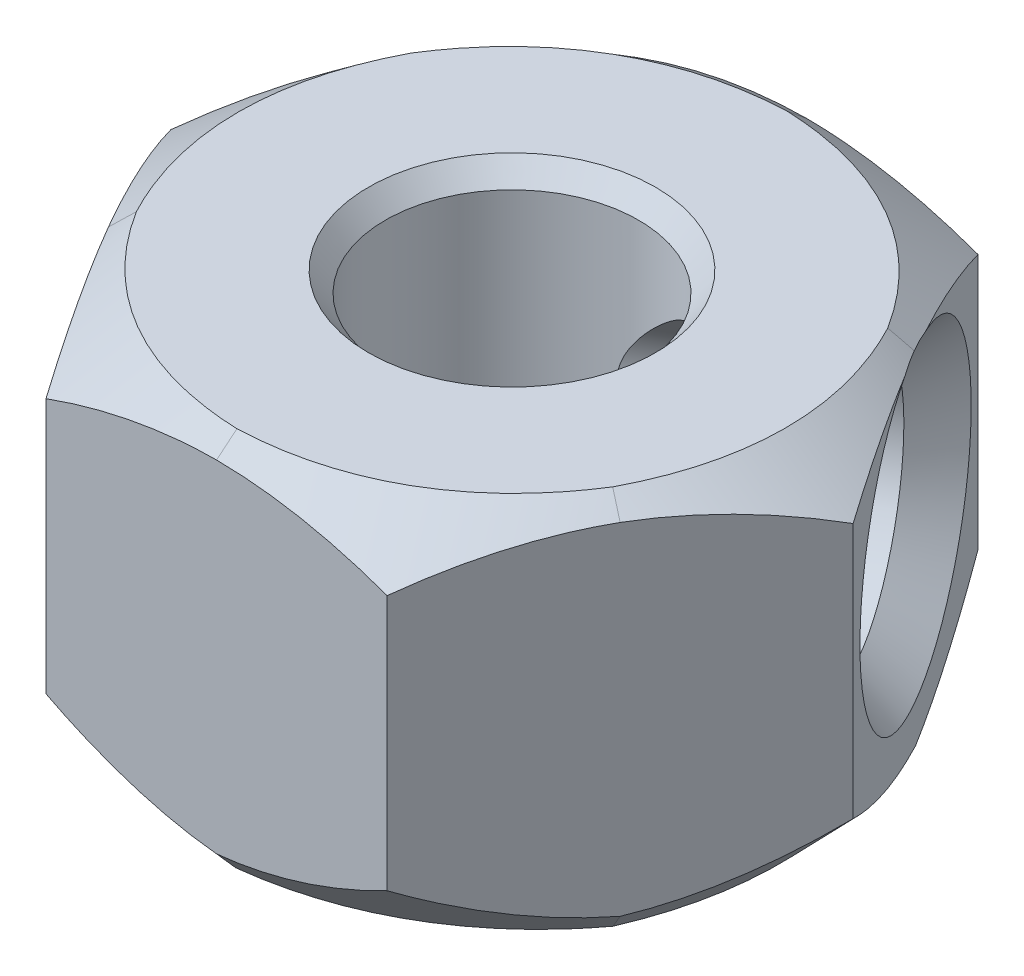
from build123d import *
from OCP.BRepFilletAPI import BRepFilletAPI_MakeChamfer

# Parameters (mm, degrees)
SKETCH1_R           = 1.5
BOSS_EXTRUDE1_DEPTH = 4.5
CHAMFER1_SIZE       = 0.2
CHAMFER1_SIZE2      = 0.238350719
SKETCH2_R           = 1.4
CUT_EXTRUDE1_DEPTH  = 3
CHAMFER2_SIZE       = 0.4
CHAMFER2_SIZE_2     = 0.476701437
FILLET1_R           = 5.5


with BuildPart() as part:
    # Sketch1 → Boss-Extrude1 (new body)
    with BuildSketch(Plane(origin=(0, 0, 0), x_dir=(1, 0, 0), z_dir=(0, 1, 0))):
        Polygon((4.041451884, 0), (2.020725942, 3.5), (-2.020725942, 3.5), (-4.041451884, 0), (-2.020725942, -3.5), (2.020725942, -3.5), align=None)
        with Locations(Location((0, 0, 0), (0, 0, 270))):
            Circle(SKETCH1_R, mode=Mode.SUBTRACT)
    extrude(amount=BOSS_EXTRUDE1_DEPTH)

    # Chamfer1: one chamfer whose edges measure the first distance from different faces: ONE call of the kernel's chamfer builder (chamfer() names one face for all edges)
    chamfer1_edges_1 = [part.edges().sort_by_distance(p)[0] for p in [
        (0, 4.5, -3.5),
    ]]
    chamfer1_side_1 = [part.faces().sort_by_distance(p)[0] for p in [
        (0, 2.25, -3.5),
    ]]
    chamfer1_edges_2 = [part.edges().sort_by_distance(p)[0] for p in [
        (-3.031088913, 4.5, -1.75),
    ]]
    chamfer1_side_2 = [part.faces().sort_by_distance(p)[0] for p in [
        (-3.031088913, 2.25, -1.75),
    ]]
    chamfer1_edges_3 = [part.edges().sort_by_distance(p)[0] for p in [
        (-3.031088913, 4.5, 1.75),
    ]]
    chamfer1_side_3 = [part.faces().sort_by_distance(p)[0] for p in [
        (-3.031088913, 2.25, 1.75),
    ]]
    chamfer1_edges_4 = [part.edges().sort_by_distance(p)[0] for p in [
        (0, 0, -1.5),
    ]]
    chamfer1_side_4 = [part.faces().sort_by_distance(p)[0] for p in [
        (0, 2.25, -1.5),
    ]]
    chamfer1_edges_5 = [part.edges().sort_by_distance(p)[0] for p in [
        (0, 4.5, -1.5),
    ]]
    chamfer1_side_5 = [part.faces().sort_by_distance(p)[0] for p in [
        (2.938487617, 4.5, -1.696536617),
    ]]
    chamfer1_edges_6 = [part.edges().sort_by_distance(p)[0] for p in [
        (0, 4.5, 3.5),
    ]]
    chamfer1_side_6 = [part.faces().sort_by_distance(p)[0] for p in [
        (0, 2.25, 3.5),
    ]]
    chamfer1_edges_7 = [part.edges().sort_by_distance(p)[0] for p in [
        (3.031088913, 4.5, 1.75),
    ]]
    chamfer1_side_7 = [part.faces().sort_by_distance(p)[0] for p in [
        (3.031088913, 2.25, 1.75),
    ]]
    chamfer1_edges_8 = [part.edges().sort_by_distance(p)[0] for p in [
        (0, 0, 3.5),
        (-3.031088913, 0, 1.75),
        (-3.031088913, 0, -1.75),
        (0, 0, -3.5),
        (3.031088913, 0, -1.75),
        (3.031088913, 0, 1.75),
    ]]
    chamfer1_side_8 = [part.faces().sort_by_distance(p)[0] for p in [
        (2.938487617, 0, -1.696536617),
    ]]
    chamfer1_edges_9 = [part.edges().sort_by_distance(p)[0] for p in [
        (3.031088913, 4.5, -1.75),
    ]]
    chamfer1_side_9 = [part.faces().sort_by_distance(p)[0] for p in [
        (3.031088913, 2.25, -1.75),
    ]]
    chamfer1 = BRepFilletAPI_MakeChamfer(part.part.solid().wrapped)
    for e in chamfer1_edges_1:
        chamfer1.Add(CHAMFER1_SIZE, CHAMFER1_SIZE2, e.wrapped, chamfer1_side_1[0].wrapped)  # the first distance lies on this face
    for e in chamfer1_edges_2:
        chamfer1.Add(CHAMFER1_SIZE, CHAMFER1_SIZE2, e.wrapped, chamfer1_side_2[0].wrapped)  # the first distance lies on this face
    for e in chamfer1_edges_3:
        chamfer1.Add(CHAMFER1_SIZE, CHAMFER1_SIZE2, e.wrapped, chamfer1_side_3[0].wrapped)  # the first distance lies on this face
    for e in chamfer1_edges_4:
        chamfer1.Add(CHAMFER1_SIZE, CHAMFER1_SIZE2, e.wrapped, chamfer1_side_4[0].wrapped)  # the first distance lies on this face
    for e in chamfer1_edges_5:
        chamfer1.Add(CHAMFER1_SIZE, CHAMFER1_SIZE2, e.wrapped, chamfer1_side_5[0].wrapped)  # the first distance lies on this face
    for e in chamfer1_edges_6:
        chamfer1.Add(CHAMFER1_SIZE, CHAMFER1_SIZE2, e.wrapped, chamfer1_side_6[0].wrapped)  # the first distance lies on this face
    for e in chamfer1_edges_7:
        chamfer1.Add(CHAMFER1_SIZE, CHAMFER1_SIZE2, e.wrapped, chamfer1_side_7[0].wrapped)  # the first distance lies on this face
    for e in chamfer1_edges_8:
        chamfer1.Add(CHAMFER1_SIZE, CHAMFER1_SIZE2, e.wrapped, chamfer1_side_8[0].wrapped)  # the first distance lies on this face
    for e in chamfer1_edges_9:
        chamfer1.Add(CHAMFER1_SIZE, CHAMFER1_SIZE2, e.wrapped, chamfer1_side_9[0].wrapped)  # the first distance lies on this face
    add(Compound.cast(chamfer1.Shape()), mode=Mode.REPLACE)

    # Sketch2 → Cut-Extrude1 (cut)
    with BuildSketch(Plane(origin=(3.031088913, 0, -1.75), x_dir=(-0.5, 0, -0.8660254037844386), z_dir=(0.8660254037844387, 0, -0.5000000000000001))):
        with Locations((0, 2.519175359)):
            Circle(SKETCH2_R)
    extrude(amount=-CUT_EXTRUDE1_DEPTH, mode=Mode.SUBTRACT)

    # Chamfer2
    # the kernel refuses this chamfer: 0.476701437, 0.4 mm, written as the material it takes off along each edge
    with BuildSketch(Plane(origin=(3.031088913, 2.519175359, -1.75), x_dir=(-0.5000000000000001, 0, -0.8660254037844386), z_dir=(0, -1, 0))) as chamfer2_piece_1:
        Polygon((1.4 + CHAMFER2_SIZE, 0), (1.4, -CHAMFER2_SIZE_2), (1.4, 0), align=None)
    revolve(axis=Axis((3.031088913, 2.519175359, -1.75), (0.8660254037844387, 0, -0.5000000000000001)), mode=Mode.SUBTRACT)

    # Fillet1
    # the kernel refuses this fillet: 5.5 mm, written as the material it takes off along each edge
    with BuildSketch(Plane(origin=(0.15679227, -4.094610415, 0), x_dir=(0.2750801350308494, 0.26652756240167075, 0.9237391286459793), z_dir=(-0.6958540455341976, 0.7181832268395656, -6.118874277733391e-15)), Plane(origin=(-0.15679227, -4.094610415, 0), x_dir=(-0.2750801350308542, 0.2665275624016659, -0.9237391286459793), z_dir=(0.6958540455341957, 0.7181832268395675, 0)), Plane(origin=(-0.078396135, -4.094610415, -0.135786089), x_dir=(0.6624414843616913, 0.266527562401667, -0.7000959493361638), z_dir=(0.347927022767099, 0.7181832268395667, 0.6026272807587874)), Plane(origin=(0.078396135, -4.094610415, -0.135786089), x_dir=(0.937521619392547, 0.2665275624016655, 0.2236431793098164), z_dir=(-0.3479270227670974, 0.718183226839567, 0.6026272807587876))) as fillet1_piece_1:
        with BuildLine():
            CenterArc((FILLET1_R * 0.414643279343, FILLET1_R), FILLET1_R, 224.957975764, 45.042024236)
            Line((-FILLET1_R * 0.292981947048, FILLET1_R * 0.293412044417), (0, 0))
            Line((0, 0), (FILLET1_R * 0.414643279343, 0))
        make_face()
    extrude(amount=11.734570278, mode=Mode.SUBTRACT)
    with BuildSketch(Plane(origin=(0.078396135, -4.094610415, 0.135786089), x_dir=(0.9375216193925491, 0.26652756240166126, -0.22364317930981242), z_dir=(-0.3479270227670917, 0.7181832268395687, -0.602627280758789)), Plane(origin=(-0.078396135, -4.094610415, 0.135786089), x_dir=(0.6624414843616925, 0.2665275624016671, 0.7000959493361628), z_dir=(0.3479270227670974, 0.718183226839567, -0.6026272807587876))) as fillet1_piece_2:
        with BuildLine():
            CenterArc((FILLET1_R * 0.414643279343, -FILLET1_R), FILLET1_R, 90, 45.042024236)
            Line((-FILLET1_R * 0.292981947048, -FILLET1_R * 0.293412044417), (0, 0))
            Line((0, 0), (FILLET1_R * 0.414643279343, 0))
        make_face()
    extrude(amount=11.734570278, mode=Mode.SUBTRACT)
    with BuildSketch(Plane(origin=(3.908343828, 1.556605641, -6.769450083), x_dir=(0.7256118681846667, -0.25999585509227957, 0.6370946335391565), z_dir=(-0.40448174665200637, 0.5878588831525535, 0.7005829359354784)), Plane(origin=(-3.908343828, 1.556605641, -6.769450083), x_dir=(0.9145460713519834, -0.25999585509227496, -0.3098509943658236), z_dir=(0.4044817466520002, 0.5878588831525553, 0.7005829359354805)), Plane(origin=(-7.816687655, 1.556605641, 0), x_dir=(0.18893420316732476, -0.2599958550922833, -0.9469456279049819), z_dir=(0.8089634933040146, 0.5878588831525519, 7.47827698098615e-15))) as fillet1_piece_3:
        with BuildLine():
            CenterArc((FILLET1_R * 0.339400484434, -FILLET1_R), FILLET1_R, 90, 37.494474502)
            Line((-FILLET1_R * 0.269284432231, -FILLET1_R * 0.206587955583), (0, 0))
            Line((0, 0), (FILLET1_R * 0.339400484434, 0))
        make_face()
    extrude(amount=9.673731027, mode=Mode.SUBTRACT)
    with BuildSketch(Plane(origin=(7.816687655, 1.556605641, 0), x_dir=(-0.18893420316731485, -0.2599958550922788, -0.946945627904985), z_dir=(-0.8089634933040131, 0.587858883152554, 0)), Plane(origin=(3.908343828, 1.556605641, 6.769450083), x_dir=(0.7256118681846656, -0.25999585509228007, -0.6370946335391575), z_dir=(-0.40448174665200737, 0.5878588831525533, -0.7005829359354782)), Plane(origin=(-3.908343828, 1.556605641, 6.769450083), x_dir=(0.9145460713519806, -0.25999585509227907, 0.30985099436582814), z_dir=(0.4044817466520063, 0.5878588831525535, -0.7005829359354784))) as fillet1_piece_4:
        with BuildLine():
            CenterArc((FILLET1_R * 0.339400484434, FILLET1_R), FILLET1_R, 232.505525498, 37.494474502)
            Line((-FILLET1_R * 0.269284432231, FILLET1_R * 0.206587955583), (0, 0))
            Line((0, 0), (FILLET1_R * 0.339400484434, 0))
        make_face()
    extrude(amount=9.673731027, mode=Mode.SUBTRACT)


solid = part.part
